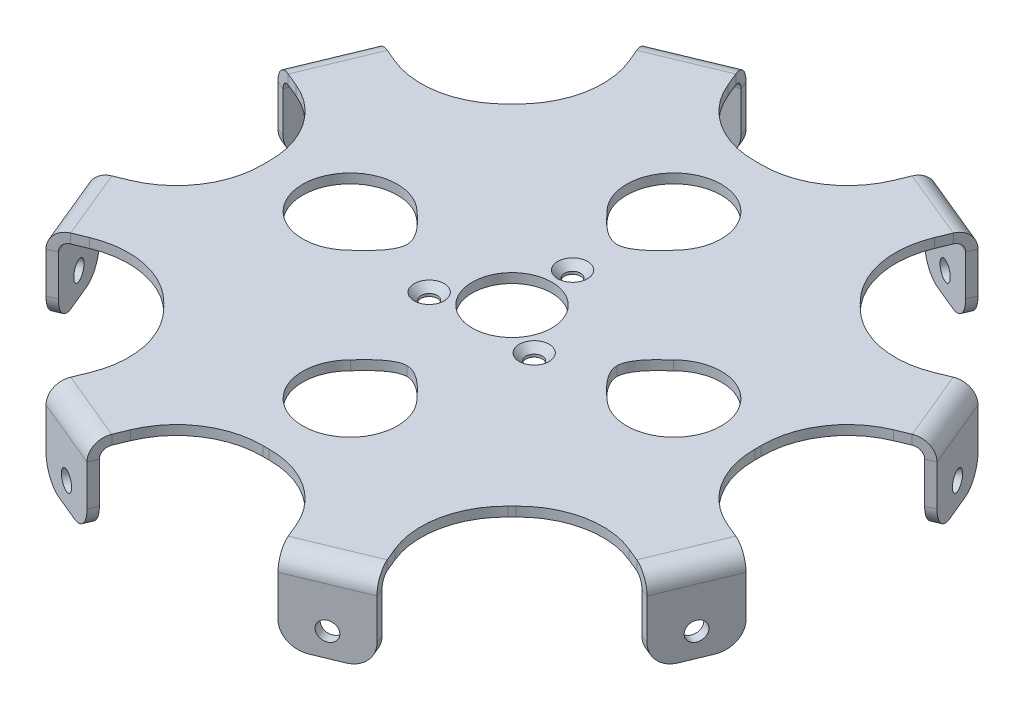
from build123d import *

# Parameters (mm, degrees)
SKIZZE1_R                       = 10.5
SKIZZE1_R_2                     = 2.15
BASIS_BLECH1_DEPTH              = 2.5
KANTE_LASCHE1_STRIP_W           = 15
KANTE_LASCHE1_STRIP_H           = 2.5
KANTE_LASCHE1_STRIP_CUT_DEPTH   = 20
KANTE_LASCHE1_DEPTH             = 20
SKIZZE5_R                       = 2.5
SCHNITT_LINEAR_AUSTRAGEN1_DEPTH = 211.163689464
VERRUNDUNG1_R                   = 6.25
KREISMUSTER1_COUNT              = 8
VERRUNDUNG1_OF_KREISMUSTER1_R   = 6.25
FASE1_SIZE                      = 1.8


# Sheet-metal steps are written as plain solids
with BuildPart() as part:
    # Skizze1 → Basis-Blech1 (new body)
    with BuildSketch(Plane(origin=(0, 0, 0), x_dir=(1, 0, 0), z_dir=(0, 1, 0))):
        with BuildLine():
            Line((-79.322323602, 43.680304238), (-86.97599225, 25.202713588))
            Line((-86.97599225, 25.202713588), (-78.883162357, 21.850553688))
            ThreePointArc((-78.883162357, 21.850553688), (-68.70986778, 13.44969523), (-64.995200835, 0.789853411))
            ThreePointArc((-64.995200835, 0.789853411), (-65, 0), (-64.995200835, -0.789853411))
            ThreePointArc((-64.995200835, -0.789853411), (-68.70986778, -13.44969523), (-78.883162357, -21.850553688))
            Line((-78.883162357, -21.850553688), (-86.97599225, -25.202713588))
            Line((-86.97599225, -25.202713588), (-79.322323602, -43.680304238))
            Line((-79.322323602, -43.680304238), (-71.22949371, -40.328144339))
            ThreePointArc((-71.22949371, -40.328144339), (-58.095584144, -39.074842739), (-46.517057958, -45.400036552))
            ThreePointArc((-46.517057958, -45.400036552), (-45.961940777, -45.961940777), (-45.400036552, -46.517057958))
            ThreePointArc((-45.400036552, -46.517057958), (-39.074842739, -58.095584144), (-40.328144339, -71.22949371))
            Line((-40.328144339, -71.22949371), (-43.680304238, -79.322323602))
            Line((-43.680304238, -79.322323602), (-25.202713588, -86.97599225))
            Line((-25.202713588, -86.97599225), (-21.850553688, -78.883162357))
            ThreePointArc((-21.850553688, -78.883162357), (-13.44969523, -68.70986778), (-0.789853411, -64.995200835))
            ThreePointArc((-0.789853411, -64.995200835), (0, -65), (0.789853411, -64.995200835))
            ThreePointArc((0.789853411, -64.995200835), (13.44969523, -68.70986778), (21.850553688, -78.883162357))
            Line((21.850553688, -78.883162357), (25.202713588, -86.97599225))
            Line((25.202713588, -86.97599225), (43.680304238, -79.322323602))
            Line((43.680304238, -79.322323602), (40.328144339, -71.22949371))
            ThreePointArc((40.328144339, -71.22949371), (39.074842739, -58.095584144), (45.400036552, -46.517057958))
            ThreePointArc((45.400036552, -46.517057958), (45.961940777, -45.961940777), (46.517057958, -45.400036552))
            ThreePointArc((46.517057958, -45.400036552), (58.095584144, -39.074842739), (71.22949371, -40.328144339))
            Line((71.22949371, -40.328144339), (79.322323602, -43.680304238))
            Line((79.322323602, -43.680304238), (86.97599225, -25.202713588))
            Line((86.97599225, -25.202713588), (78.883162357, -21.850553688))
            ThreePointArc((78.883162357, -21.850553688), (68.70986778, -13.44969523), (64.995200835, -0.789853411))
            ThreePointArc((64.995200835, -0.789853411), (65, 0), (64.995200835, 0.789853411))
            ThreePointArc((64.995200835, 0.789853411), (68.70986778, 13.44969523), (78.883162357, 21.850553688))
            Line((78.883162357, 21.850553688), (86.97599225, 25.202713588))
            Line((86.97599225, 25.202713588), (79.322323602, 43.680304238))
            Line((79.322323602, 43.680304238), (71.22949371, 40.328144339))
            ThreePointArc((71.22949371, 40.328144339), (58.095584144, 39.074842739), (46.517057958, 45.400036552))
            ThreePointArc((46.517057958, 45.400036552), (45.961940777, 45.961940777), (45.400036552, 46.517057958))
            ThreePointArc((45.400036552, 46.517057958), (39.074842739, 58.095584144), (40.328144339, 71.22949371))
            Line((40.328144339, 71.22949371), (43.680304238, 79.322323602))
            Line((43.680304238, 79.322323602), (25.202713588, 86.97599225))
            Line((25.202713588, 86.97599225), (21.850553688, 78.883162357))
            ThreePointArc((21.850553688, 78.883162357), (13.44969523, 68.70986778), (0.789853411, 64.995200835))
            ThreePointArc((0.789853411, 64.995200835), (0, 65), (-0.789853411, 64.995200835))
            ThreePointArc((-0.789853411, 64.995200835), (-13.44969523, 68.70986778), (-21.850553688, 78.883162357))
            Line((-21.850553688, 78.883162357), (-25.202713588, 86.97599225))
            Line((-25.202713588, 86.97599225), (-43.680304238, 79.322323602))
            Line((-43.680304238, 79.322323602), (-40.328144339, 71.22949371))
            ThreePointArc((-40.328144339, 71.22949371), (-39.074842739, 58.095584144), (-45.400036552, 46.517057958))
            ThreePointArc((-45.400036552, 46.517057958), (-45.961940777, 45.961940777), (-46.517057958, 45.400036552))
            ThreePointArc((-46.517057958, 45.400036552), (-58.095584144, 39.074842739), (-71.22949371, 40.328144339))
            Line((-71.22949371, 40.328144339), (-79.322323602, 43.680304238))
        make_face()
        with Locations(Location((0, 0, 0), (0, 0, 270))):
            Circle(SKIZZE1_R, mode=Mode.SUBTRACT)
        with Locations(Location((0, 16, 0), (0, 0, 270))):
            Circle(SKIZZE1_R_2, mode=Mode.SUBTRACT)
        with Locations(Location((13.856406461, -8, 0), (0, 0, 270))):
            Circle(SKIZZE1_R_2, mode=Mode.SUBTRACT)
        with Locations(Location((-13.856406461, -8, 0), (0, 0, 270))):
            Circle(SKIZZE1_R_2, mode=Mode.SUBTRACT)
        with BuildLine():
            ThreePointArc((-8.79984027, -33.872348097), (0, -55.249995684), (8.79984027, -33.872348097))
            add(Edge.make_bspline(
                [(0.000337163, -27.702664244), (3.389740955, -27.702664244), (8.79984027, -33.872348097)],
                knots=[0, 0, 0, 1, 1, 1], degree=2))
            add(Edge.make_bspline(
                [(0.000337163, -27.702664244), (-3.389066629, -27.702664244), (-8.79984027, -33.872348097)],
                knots=[0, 0, 0, 1, 1, 1], degree=2))
        make_face(mode=Mode.SUBTRACT)
        with BuildLine():
            ThreePointArc((-33.872348097, 8.79984027), (-55.249995684, 0), (-33.872348097, -8.79984027))
            add(Edge.make_bspline(
                [(-27.702664244, -0.000337163), (-27.702664244, -3.389740955), (-33.872348097, -8.79984027)],
                knots=[0, 0, 0, 1, 1, 1], degree=2))
            add(Edge.make_bspline(
                [(-27.702664244, -0.000337163), (-27.702664244, 3.389066629), (-33.872348097, 8.79984027)],
                knots=[0, 0, 0, 1, 1, 1], degree=2))
        make_face(mode=Mode.SUBTRACT)
        with BuildLine():
            ThreePointArc((8.79984027, 33.872348097), (0, 55.249995684), (-8.79984027, 33.872348097))
            add(Edge.make_bspline(
                [(-0.000337163, 27.702664244), (-3.389740955, 27.702664244), (-8.79984027, 33.872348097)],
                knots=[0, 0, 0, 1, 1, 1], degree=2))
            add(Edge.make_bspline(
                [(-0.000337163, 27.702664244), (3.389066629, 27.702664244), (8.79984027, 33.872348097)],
                knots=[0, 0, 0, 1, 1, 1], degree=2))
        make_face(mode=Mode.SUBTRACT)
        with BuildLine():
            ThreePointArc((33.872348097, -8.79984027), (55.249995684, 0), (33.872348097, 8.79984027))
            add(Edge.make_bspline(
                [(27.702664244, 0.000337163), (27.702664244, 3.389740955), (33.872348097, 8.79984027)],
                knots=[0, 0, 0, 1, 1, 1], degree=2))
            add(Edge.make_bspline(
                [(27.702664244, 0.000337163), (27.702664244, -3.389066629), (33.872348097, -8.79984027)],
                knots=[0, 0, 0, 1, 1, 1], degree=2))
        make_face(mode=Mode.SUBTRACT)
    extrude(amount=-BASIS_BLECH1_DEPTH)

    # Kante-Lasche1 strip (across the edge) → Kante-Lasche1 strip cut (cut)
    with BuildSketch(Plane(origin=(-86.97599225, -2.5, -25.202713588), x_dir=(0.9238795325112853, -3.4914813388431334e-15, 0.3826834323650935), z_dir=(0.3826834323650935, 0, -0.9238795325112853))):
        with Locations((-2.5, -1.25)):
            Rectangle(KANTE_LASCHE1_STRIP_W, KANTE_LASCHE1_STRIP_H)
    kante_lasche1_strip_cut = extrude(amount=KANTE_LASCHE1_STRIP_CUT_DEPTH, mode=Mode.SUBTRACT)

    # Kante-Lasche1 section (across the edge) → Kante-Lasche1 (add)
    with BuildSketch(Plane(origin=(-86.97599225, -2.5, -25.202713588), x_dir=(0.9238795325112853, -3.4914813388431334e-15, 0.3826834323650935), z_dir=(0.3826834323650935, 0, -0.9238795325112853))):
        with BuildLine():
            Line((0, 2.5), (0, 19.5))
            Line((0, 19.5), (2.5, 19.5))
            Line((2.5, 19.5), (2.5, 2.5))
            ThreePointArc((2.5, 2.5), (3.232233047, 0.732233047), (5, 0))
            Line((5, 0), (5, -2.5))
            ThreePointArc((5, -2.5), (1.464466094, -1.035533906), (0, 2.5))
        make_face()
    kante_lasche1 = extrude(amount=KANTE_LASCHE1_DEPTH)

    # Skizze5 → Schnitt-Linear austragen1 (cut, through all)
    with BuildSketch(Plane(origin=(-83.149157926, 0, -34.441508913), x_dir=(-0.3826834323650939, -1.5834132671090841e-15, 0.9238795325112851), z_dir=(-0.9238795325112851, -3.822697784296196e-15, -0.3826834323650939))):
        with Locations((0, -15.75)):
            Circle(SKIZZE5_R)
    schnitt_linear_austragen1 = extrude(amount=-SCHNITT_LINEAR_AUSTRAGEN1_DEPTH, mode=Mode.SUBTRACT)

    # Verrundung1
    verrundung1_edges = [part.edges().sort_by_distance(p)[0] for p in [
        (-85.821142834, -22, -24.724359297),
        (-78.167474187, -22, -43.201949948),
    ]]
    fillet(verrundung1_edges, radius=VERRUNDUNG1_R)

    # Kreismuster1: Kante-Lasche1 strip cut, Kante-Lasche1, Schnitt-Linear austragen1 ×8 about axis
    kreismuster1_axis = Axis((0, 0, 0), (0, 1, 0))
    add([kante_lasche1_strip_cut.rotate(kreismuster1_axis, i * 360 / KREISMUSTER1_COUNT) for i in range(1, KREISMUSTER1_COUNT)], mode=Mode.SUBTRACT)
    add([kante_lasche1.rotate(kreismuster1_axis, i * 360 / KREISMUSTER1_COUNT) for i in range(1, KREISMUSTER1_COUNT)])
    add([schnitt_linear_austragen1.rotate(kreismuster1_axis, i * 360 / KREISMUSTER1_COUNT) for i in range(1, KREISMUSTER1_COUNT)], mode=Mode.SUBTRACT)

    # Verrundung1 of Kreismuster1
    verrundung1_of_kreismuster1_edges = [part.edges().sort_by_distance(p)[0] for p in [
        (-78.167474187, -22, 43.201949948),
        (-85.821142834, -22, 24.724359297),
        (-24.724359297, -22, 85.821142834),
        (-43.201949948, -22, 78.167474187),
        (43.201949948, -22, 78.167474187),
        (24.724359297, -22, 85.821142834),
        (85.821142834, -22, 24.724359297),
        (78.167474187, -22, 43.201949948),
        (78.167474187, -22, -43.201949948),
        (85.821142834, -22, -24.724359297),
        (24.724359297, -22, -85.821142834),
        (43.201949948, -22, -78.167474187),
        (-43.201949948, -22, -78.167474187),
        (-24.724359297, -22, -85.821142834),
    ]]
    fillet(verrundung1_of_kreismuster1_edges, radius=VERRUNDUNG1_OF_KREISMUSTER1_R)

    # Fase1
    fase1_edges = [part.edges().sort_by_distance(p)[0] for p in [
        (0, 0, -18.15),
        (13.856406461, 0, 5.85),
        (-13.856406461, 0, 5.85),
    ]]
    chamfer(fase1_edges, length=FASE1_SIZE)


solid = part.part
